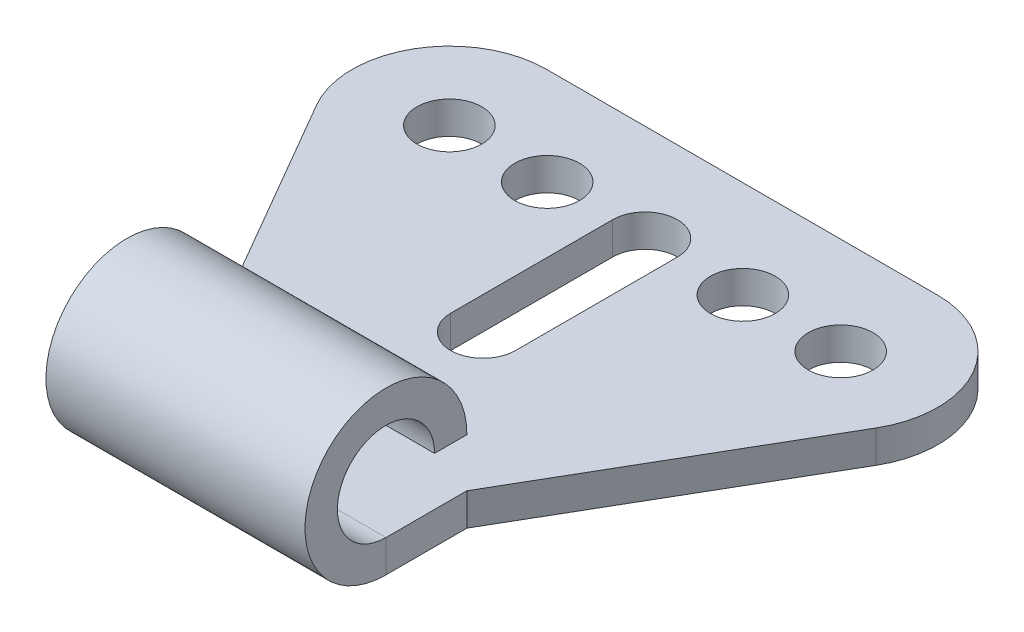
from build123d import *

# Parameters (mm, degrees)
SKETCH_1_R             = 2
SM_BASE_FLANGE_1_DEPTH = 2
OTHER_START            = -8
OTHER_1_DEPTH          = 16


# Read off the part's stored shape, not the designer's step: 褶边1
# Sheet-metal steps are written as plain solids
with BuildPart() as part:
    # Sketch 1 → 基体-法兰1 (new body)
    with BuildSketch(Plane(origin=(0, 0, 0), x_dir=(1, 0, 0), z_dir=(0, 1, 0))):
        with BuildLine():
            Line((-12.083833912, 25), (12.083833912, 25))
            ThreePointArc((12.083833912, 25), (17.282961302, 21.994841295), (17.274021048, 15.989691461))
            Line((17.274021048, 15.989691461), (8, 0))
            Line((8, 0), (8, -5))
            Line((8, -5), (-8, -5))
            Line((-8, -5), (-8, 0))
            Line((-8, 0), (-17.274021048, 15.989691461))
            ThreePointArc((-17.274021048, 15.989691461), (-17.282961302, 21.994841295), (-12.083833912, 25))
        make_face()
        with Locations(Location((-12.083833912, 19, 0), (0, 0, 270))):
            Circle(SKETCH_1_R, mode=Mode.SUBTRACT)
        with Locations(Location((-6.041916956, 19, 0), (0, 0, 270))):
            Circle(SKETCH_1_R, mode=Mode.SUBTRACT)
        with Locations(Location((6.041916956, 19, 0), (0, 0, 270))):
            Circle(SKETCH_1_R, mode=Mode.SUBTRACT)
        with Locations(Location((12.083833912, 19, 0), (0, 0, 270))):
            Circle(SKETCH_1_R, mode=Mode.SUBTRACT)
        with BuildLine():
            Line((-2, 19), (-2, 9))
            ThreePointArc((-2, 9), (0, 7), (2, 9))
            Line((2, 9), (2, 19))
            ThreePointArc((2, 19), (0, 21), (-2, 19))
        make_face(mode=Mode.SUBTRACT)
    extrude(amount=SM_BASE_FLANGE_1_DEPTH)

    # Other 1 outline → Other 1 (add)
    with BuildSketch(Plane.YZ.offset(OTHER_START)):
        with BuildLine():
            Line((5, 2), (5, 0))
            ThreePointArc((5, 0), (8.535533906, 8.535533906), (0, 5))
            Line((0, 5), (2, 5))
            ThreePointArc((2, 5), (7.121320344, 7.121320344), (5, 2))
        make_face()
    extrude(amount=OTHER_1_DEPTH)


solid = part.part
